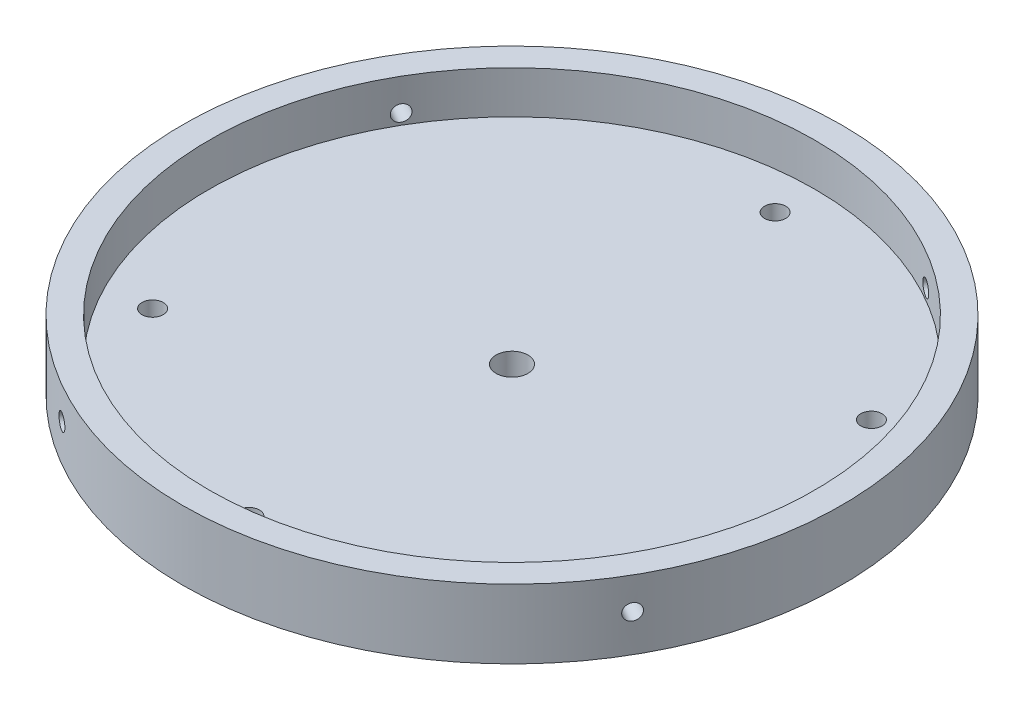
from build123d import *

# Parameters (mm, degrees)
SKETCH1_R               = 62
BOSS_EXTRUDE1_DEPTH     = 5
SKETCH2_R               = 2
CUT_EXTRUDE1_DEPTH      = 5
CIRPATTERN1_COUNT       = 2
CIRPATTERN1_ANGLE       = 120
MIRROR1_COPY_1_SKETCH_R = 2
MIRROR1_COPY_1_DEPTH    = 5
SKETCH5_R               = 62
SKETCH5_R_2             = 57
BOSS_EXTRUDE2_DEPTH     = 8
CUT_EXTRUDE2_START      = -90
SKETCH6_R               = 1.5
CUT_EXTRUDE2_DEPTH      = 192
CIRPATTERN2_COUNT       = 2
CIRPATTERN2_ANGLE       = 90
SKETCH7_R               = 3
CUT_EXTRUDE3_DEPTH      = 10


with BuildPart() as part:
    # Sketch1 → Boss-Extrude1 (new body)
    with BuildSketch(Plane(origin=(0, 0, 0), x_dir=(1, 0, 0), z_dir=(0, 1, 0))):
        Circle(SKETCH1_R)
    extrude(amount=BOSS_EXTRUDE1_DEPTH)

    # Sketch2 → Cut-Extrude1 (cut)
    with BuildSketch(Plane(origin=(0, 5, 0), x_dir=(1, 0, 0), z_dir=(0, 1, 0))):
        with Locations((0, 49.5)):
            Circle(SKETCH2_R)
    cut_extrude1 = extrude(amount=-CUT_EXTRUDE1_DEPTH, mode=Mode.SUBTRACT)

    # CirPattern1: Cut-Extrude1 ×2 about axis
    cirpattern1_axis = Axis((0, 5, 0), (0, 1, 0))
    for i in range(1, CIRPATTERN1_COUNT):
        add(cut_extrude1.rotate(cirpattern1_axis, i * CIRPATTERN1_ANGLE / (CIRPATTERN1_COUNT - 1)), mode=Mode.SUBTRACT)

    # Mirror1: Cut-Extrude1 across plane
    add(cut_extrude1.mirror(Plane(origin=(0, 0, 0), x_dir=(-0.49999999999999806, 0, 0.8660254037844398), z_dir=(-0.8660254037844398, 0, -0.49999999999999806))), mode=Mode.SUBTRACT)

    # Mirror1 copy 1 sketch → Mirror1 copy 1 (cut)
    with BuildSketch(Plane(origin=(0, 5, 0), x_dir=(1, 0, 0), z_dir=(0, 1, 0))):
        with Locations((0, -49.5)):
            Circle(MIRROR1_COPY_1_SKETCH_R)
    extrude(amount=-MIRROR1_COPY_1_DEPTH, mode=Mode.SUBTRACT)

    # Sketch5 → Boss-Extrude2 (add)
    with BuildSketch(Plane(origin=(0, 5, 0), x_dir=(1, 0, 0), z_dir=(0, 1, 0))):
        Circle(SKETCH5_R)
        Circle(SKETCH5_R_2, mode=Mode.SUBTRACT)
    extrude(amount=BOSS_EXTRUDE2_DEPTH)

    # Sketch6 → Cut-Extrude2 (cut)
    with BuildSketch(Plane(origin=(0, 0, 0), x_dir=(-0.49999999999999806, 0, 0.8660254037844398), z_dir=(-0.8660254037844398, 0, -0.49999999999999806)).offset(CUT_EXTRUDE2_START)):
        with Locations((0, 7)):
            Circle(SKETCH6_R)
    cut_extrude2 = extrude(amount=CUT_EXTRUDE2_DEPTH, mode=Mode.SUBTRACT)

    # CirPattern2: Cut-Extrude2 ×2 about axis
    cirpattern2_axis = Axis((0, 13, 0), (0, 1, 0))
    for i in range(1, CIRPATTERN2_COUNT):
        add(cut_extrude2.rotate(cirpattern2_axis, i * CIRPATTERN2_ANGLE / (CIRPATTERN2_COUNT - 1)), mode=Mode.SUBTRACT)

    # Sketch7 → Cut-Extrude3 (cut)
    with BuildSketch(Plane(origin=(0, 5, 0), x_dir=(1, 0, 0), z_dir=(0, 1, 0))):
        Circle(SKETCH7_R)
    extrude(amount=-CUT_EXTRUDE3_DEPTH, mode=Mode.SUBTRACT)


solid = part.part
